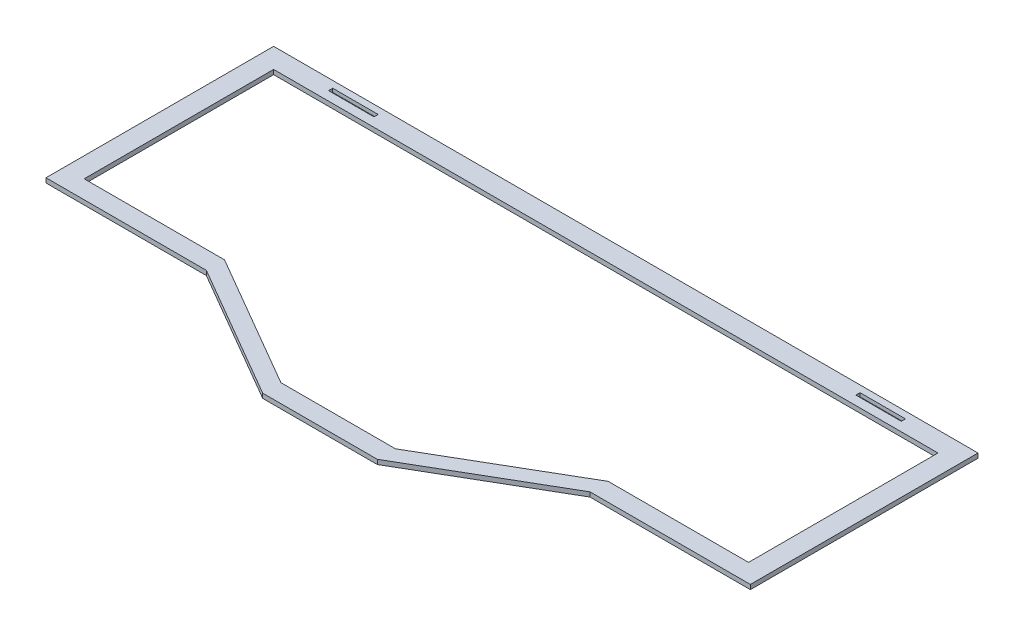
from build123d import *

# Parameters (mm, degrees)
SKETCH1_W           = 387.4
SKETCH1_H           = 169.4
BOSS_EXTRUDE1_DEPTH = 2.5
SKETCH3_W           = 25
SKETCH3_H           = 2.3
CUT_EXTRUDE2_DEPTH  = 2
CUT_EXTRUDE3_DEPTH  = 10
CUT_EXTRUDE4_DEPTH  = 212.423816066


with BuildPart() as part:
    # Sketch1 → Boss-Extrude1 (new body)
    with BuildSketch(Plane(origin=(0, 0, 0), x_dir=(1, 0, 0), z_dir=(0, 1, 0))):
        Rectangle(SKETCH1_W, SKETCH1_H)
    extrude(amount=BOSS_EXTRUDE1_DEPTH)

    # Sketch3 → Cut-Extrude2 (cut)
    with BuildSketch(Plane(origin=(0, 2.5, 0), x_dir=(1, 0, 0), z_dir=(0, 1, 0))):
        with Locations((145, 79.85)):
            Rectangle(SKETCH3_W, SKETCH3_H)
        with Locations((-145, 79.85)):
            Rectangle(SKETCH3_W, SKETCH3_H)
    extrude(amount=-CUT_EXTRUDE2_DEPTH, mode=Mode.SUBTRACT)

    # Sketch4 → Cut-Extrude3 (cut)
    with BuildSketch(Plane.XZ):
        Polygon((31.499996994, 73.5), (105.5, 30.5), (182.7, 30.5), (182.7, -73.7), (-182.7, -73.7), (-182.7, 30.5), (-105.5, 30.5), (-31.499996994, 73.5), align=None)
    extrude(amount=-CUT_EXTRUDE3_DEPTH, mode=Mode.SUBTRACT)

    # Sketch7 → Cut-Extrude4 (cut, through all)
    with BuildSketch(Plane.XZ):
        Polygon((193.7, 40.5), (105.5, 40.5), (31.499996994, 83.5), (-31.499996994, 83.5), (-105.5, 40.5), (-193.7, 40.5), (-193.7, 84.7), (193.7, 84.7), align=None)
    extrude(amount=-CUT_EXTRUDE4_DEPTH, mode=Mode.SUBTRACT)


solid = part.part
